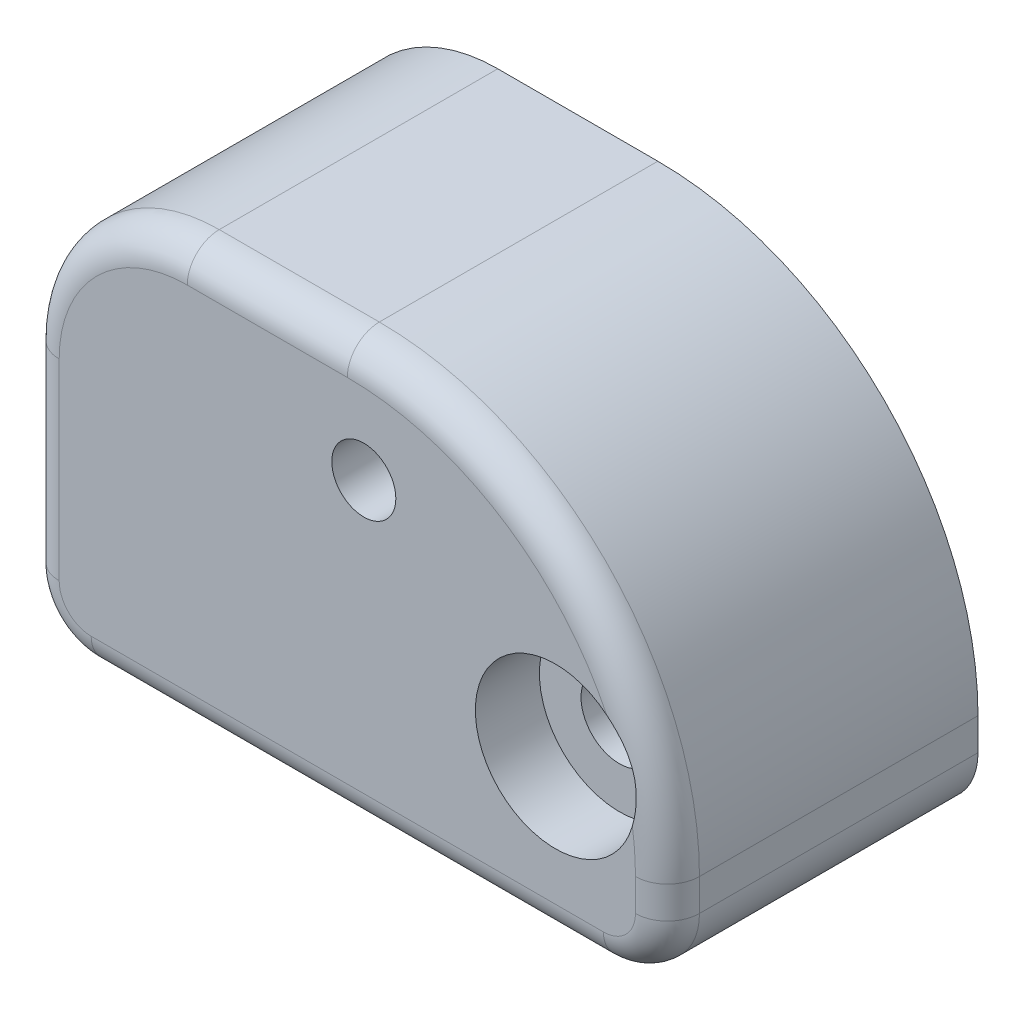
from build123d import *

# Parameters (mm, degrees)
SKETCH1_W               = 20
SKETCH1_H               = 13
SKETCH1_R               = 1.2
BOSS_EXTRUDE1_DEPTH     = 5.8
SKETCH2_R               = 2.5
CUT_EXTRUDE1_DEPTH      = 2
SKETCH3_R               = 1.5
CUT_EXTRUDE2_DEPTH      = 10
FILLET1_R               = 10
FILLET2_R               = 5
FILLET3_R               = 2
FILLET4_R               = 1
SKETCH5_R               = 1.2
BOSS_EXTRUDE2_DEPTH     = 3.9
CUT_EXTRUDE3_DEPTH      = 26.750534103
CUT_EXTRUDE3_DEPTH_BACK = 26.750534103
SKETCH6_R               = 1


with BuildPart() as part:
    # Sketch1 → Boss-Extrude1 (new body)
    with BuildSketch(Plane.XY):
        with Locations((10, 6.5)):
            Rectangle(SKETCH1_W, SKETCH1_H)
        with Locations((16.5, 5)):
            Circle(SKETCH1_R, mode=Mode.SUBTRACT)
    extrude(amount=BOSS_EXTRUDE1_DEPTH)

    # Sketch2 → Cut-Extrude1 (cut)
    with BuildSketch(Plane.XY.offset(5.8)):
        with Locations((16.5, 5)):
            Circle(SKETCH2_R)
    extrude(amount=-CUT_EXTRUDE1_DEPTH, mode=Mode.SUBTRACT)

    # Sketch3 → Cut-Extrude2 (cut)
    with BuildSketch(Plane.ZY):
        with Locations((2.8, 5)):
            Circle(SKETCH3_R)
    extrude(amount=-CUT_EXTRUDE2_DEPTH, mode=Mode.SUBTRACT)

    # Fillet1
    fillet1_edges = [part.edges().sort_by_distance(p)[0] for p in [
        (20, 13, 2.9),
    ]]
    fillet(fillet1_edges, radius=FILLET1_R)

    # Fillet2
    fillet2_edges = [part.edges().sort_by_distance(p)[0] for p in [
        (0, 13, 2.9),
    ]]
    fillet(fillet2_edges, radius=FILLET2_R)

    # Fillet3
    fillet3_edges = [part.edges().sort_by_distance(p)[0] for p in [
        (0, 0, 2.9),
        (20, 0, 2.9),
    ]]
    fillet(fillet3_edges, radius=FILLET3_R)

    # Fillet4
    # the kernel refuses this fillet: 1 mm, written as the material it takes off along each edge
    with BuildSketch(Plane(origin=(5, 13, 5.8), x_dir=(0, 0, -1), z_dir=(1, 0, 0))) as fillet4_piece_1:
        with BuildLine():
            CenterArc((FILLET4_R, -FILLET4_R), FILLET4_R, 90, 90)
            Line((0, -FILLET4_R), (0, 0))
            Line((0, 0), (FILLET4_R, 0))
        make_face()
    extrude(amount=5, mode=Mode.SUBTRACT)
    with BuildSketch(Plane(origin=(10, 3, 5.8), x_dir=(0, 1, 0), z_dir=(-1, 0, 0))) as fillet4_piece_2:
        with BuildLine():
            CenterArc((10 - FILLET4_R, FILLET4_R), FILLET4_R, 270, 90)
            Line((10 - FILLET4_R, 0), (10, 0))
            Line((10, 0), (10, FILLET4_R))
        make_face()
    revolve(axis=Axis((10, 3, 5.8), (0, 0, -1)), revolution_arc=90, mode=Mode.SUBTRACT)
    with BuildSketch(Plane(origin=(0, 2, 5.8), x_dir=(0, 0, -1), z_dir=(0, 1, 0))) as fillet4_piece_3:
        with BuildLine():
            CenterArc((FILLET4_R, -FILLET4_R), FILLET4_R, 90, 90)
            Line((0, -FILLET4_R), (0, 0))
            Line((0, 0), (FILLET4_R, 0))
        make_face()
    extrude(amount=6, mode=Mode.SUBTRACT)
    with BuildSketch(Plane(origin=(5, 8, 5.8), x_dir=(0, 1, 0), z_dir=(1, 0, 0))) as fillet4_piece_4:
        with BuildLine():
            CenterArc((5 - FILLET4_R, -FILLET4_R), FILLET4_R, 0, 90)
            Line((5 - FILLET4_R, 0), (5, 0))
            Line((5, 0), (5, -FILLET4_R))
        make_face()
    revolve(axis=Axis((5, 8, 5.8), (0, 0, 1)), revolution_arc=90, mode=Mode.SUBTRACT)
    with BuildSketch(Plane(origin=(20, 3, 5.8), x_dir=(0, 0, -1), z_dir=(0, -1, 0))) as fillet4_piece_5:
        with BuildLine():
            CenterArc((FILLET4_R, -FILLET4_R), FILLET4_R, 90, 90)
            Line((0, -FILLET4_R), (0, 0))
            Line((0, 0), (FILLET4_R, 0))
        make_face()
    extrude(amount=1, mode=Mode.SUBTRACT)
    with BuildSketch(Plane(origin=(18, 0, 5.8), x_dir=(0, 0, -1), z_dir=(-1, 0, 0))) as fillet4_piece_6:
        with BuildLine():
            CenterArc((FILLET4_R, -FILLET4_R), FILLET4_R, 90, 90)
            Line((0, -FILLET4_R), (0, 0))
            Line((0, 0), (FILLET4_R, 0))
        make_face()
    extrude(amount=16, mode=Mode.SUBTRACT)
    with BuildSketch(Plane(origin=(2, 2, 5.8), x_dir=(-1, 0, 0), z_dir=(0, 1, 0))) as fillet4_piece_7:
        with BuildLine():
            CenterArc((2 - FILLET4_R, -FILLET4_R), FILLET4_R, 0, 90)
            Line((2 - FILLET4_R, 0), (2, 0))
            Line((2, 0), (2, -FILLET4_R))
        make_face()
    revolve(axis=Axis((2, 2, 5.8), (0, 0, 1)), revolution_arc=90, mode=Mode.SUBTRACT)
    with BuildSketch(Plane(origin=(18, 2, 5.8), x_dir=(1, 0, 0), z_dir=(0, 1, 0))) as fillet4_piece_8:
        with BuildLine():
            CenterArc((2 - FILLET4_R, FILLET4_R), FILLET4_R, 270, 90)
            Line((2 - FILLET4_R, 0), (2, 0))
            Line((2, 0), (2, FILLET4_R))
        make_face()
    revolve(axis=Axis((18, 2, 5.8), (0, 0, -1)), revolution_arc=90, mode=Mode.SUBTRACT)

    # Sketch5 → Boss-Extrude2 (add)
    with BuildSketch(Plane(origin=(0, 0, 0), x_dir=(-1, 0, 0), z_dir=(0, 0, -1))):
        with BuildLine():
            Line((-20, 3), (-20, 2))
            ThreePointArc((-20, 2), (-19.414213562, 0.585786438), (-18, 0))
            Line((-18, 0), (-2, 0))
            ThreePointArc((-2, 0), (-0.585786438, 0.585786438), (0, 2))
            Line((0, 2), (0, 8))
            ThreePointArc((0, 8), (-1.464466094, 11.535533906), (-5, 13))
            Line((-5, 13), (-10, 13))
            ThreePointArc((-10, 13), (-17.071067812, 10.071067812), (-20, 3))
        make_face()
        with Locations((-16.5, 5)):
            Circle(SKETCH5_R, mode=Mode.SUBTRACT)
    extrude(amount=BOSS_EXTRUDE2_DEPTH)

    # Sketch6 → Cut-Extrude3 (cut, two sides: drawn at the far end of the back side and taken through both)
    with BuildSketch(Plane.XY.offset(5.8).offset(-CUT_EXTRUDE3_DEPTH_BACK)):
        with Locations((10.515506471, 9.481609927)):
            Circle(SKETCH6_R)
    extrude(amount=CUT_EXTRUDE3_DEPTH + CUT_EXTRUDE3_DEPTH_BACK, mode=Mode.SUBTRACT)


solid = part.part
